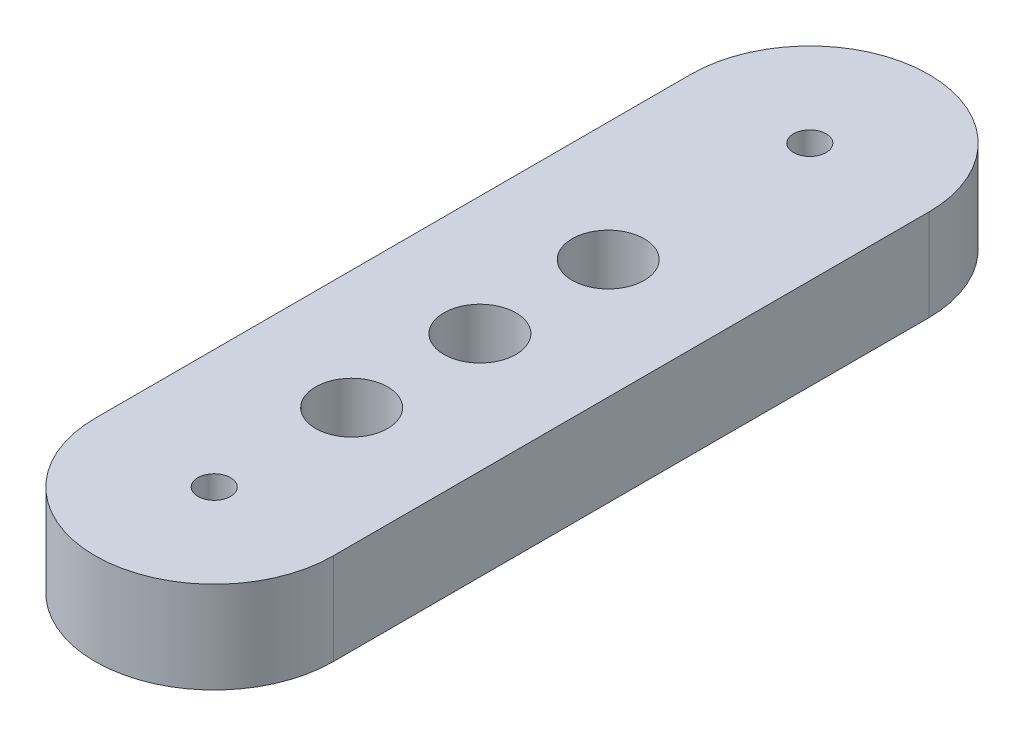
from build123d import *

# Parameters (mm, degrees)
SKETCH1_R           = 1.1303
SKETCH1_R_2         = 2.5
BOSS_EXTRUDE1_DEPTH = 6.35


with BuildPart() as part:
    # Sketch1 → Boss-Extrude1 (new body)
    with BuildSketch(Plane(origin=(0, 0, 0), x_dir=(1, 0, 0), z_dir=(0, 1, 0))):
        with BuildLine():
            Line((-8.255, -20.6375), (-8.255, 20.6375))
            ThreePointArc((-8.255, 20.6375), (0, 28.8925), (8.255, 20.6375))
            Line((8.255, 20.6375), (8.255, -20.6375))
            ThreePointArc((8.255, -20.6375), (0, -28.8925), (-8.255, -20.6375))
        make_face()
        with Locations((0, 20.6375)):
            Circle(SKETCH1_R, mode=Mode.SUBTRACT)
        with Locations((0, -20.6375)):
            Circle(SKETCH1_R, mode=Mode.SUBTRACT)
        with Locations((0, -11.1125)):
            Circle(SKETCH1_R_2, mode=Mode.SUBTRACT)
        with Locations((0, -2.2225)):
            Circle(SKETCH1_R_2, mode=Mode.SUBTRACT)
        with Locations((0, 6.6675)):
            Circle(SKETCH1_R_2, mode=Mode.SUBTRACT)
    extrude(amount=BOSS_EXTRUDE1_DEPTH)


solid = part.part
